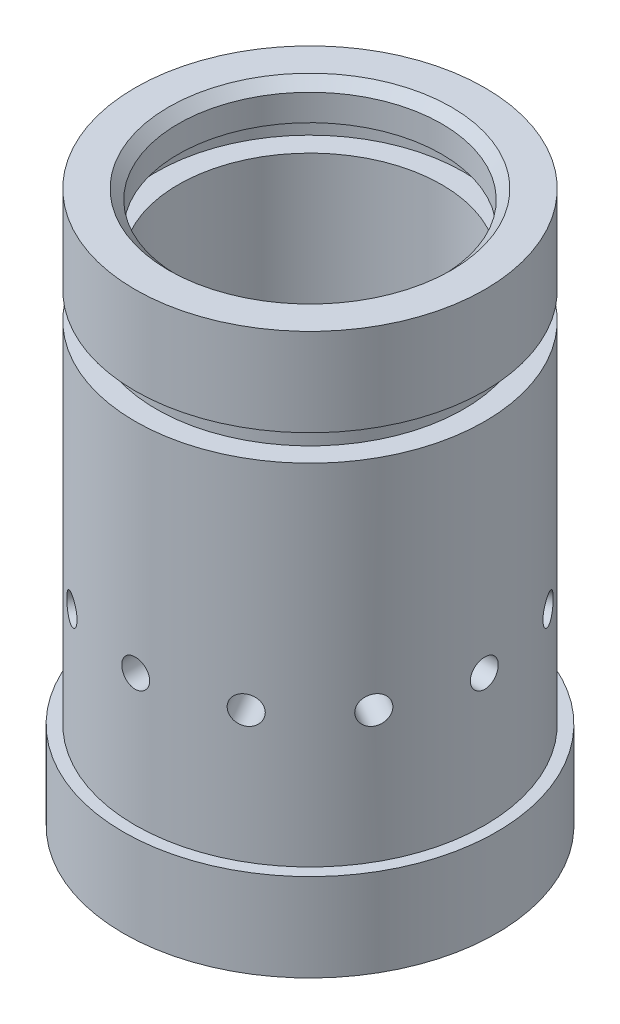
from build123d import *

# Parameters (mm, degrees)
CIRPATTERN1_COUNT = 12


with BuildPart() as part:
    # Sketch1 → Revolve1 (revolve)
    with BuildSketch(Plane.XY):
        Polygon((19.05, -23.636053449), (19.05, -57.672053449), (15.875, -57.672053449), (25.7175, -94.404763523), (26.9875, -94.404763523), (26.9875, -81.704763523), (25.2857, -81.704763523), (25.2857, -31.129053449), (22.225, -31.129053449), (22.225, -27.319053449), (25.2857, -27.319053449), (25.2857, -14.619053449), (20.447, -14.619053449), (19.05, -16.016053449), (19.05, -19.826053449), (22.225, -19.826053449), (22.225, -23.636053449), align=None)
    revolve(axis=Axis((0, 0, 0), (0, 1, 0)))

    # Sketch3 → #10-32 Tapped Hole1 (revolve, cut)
    with BuildSketch(Plane(origin=(0, -62.654763523, -25.2857), x_dir=(0, 1, 0), z_dir=(1, 0, 0))):
        Polygon((0, 0), (0, 7.563317848), (2.0193, 6.35), (2.0193, 0), align=None)
    f_10_32_tapped_hole1 = revolve(axis=Axis((0, -62.654763523, -31.6357), (0, 0, 1)), mode=Mode.SUBTRACT)

    # CirPattern1: #10-32 Tapped Hole1 ×12 about axis
    cirpattern1_axis = Axis((0, 0, 0), (0, -1, 0))
    for i in range(1, CIRPATTERN1_COUNT):
        add(f_10_32_tapped_hole1.rotate(cirpattern1_axis, i * 360 / CIRPATTERN1_COUNT), mode=Mode.SUBTRACT)


solid = part.part
